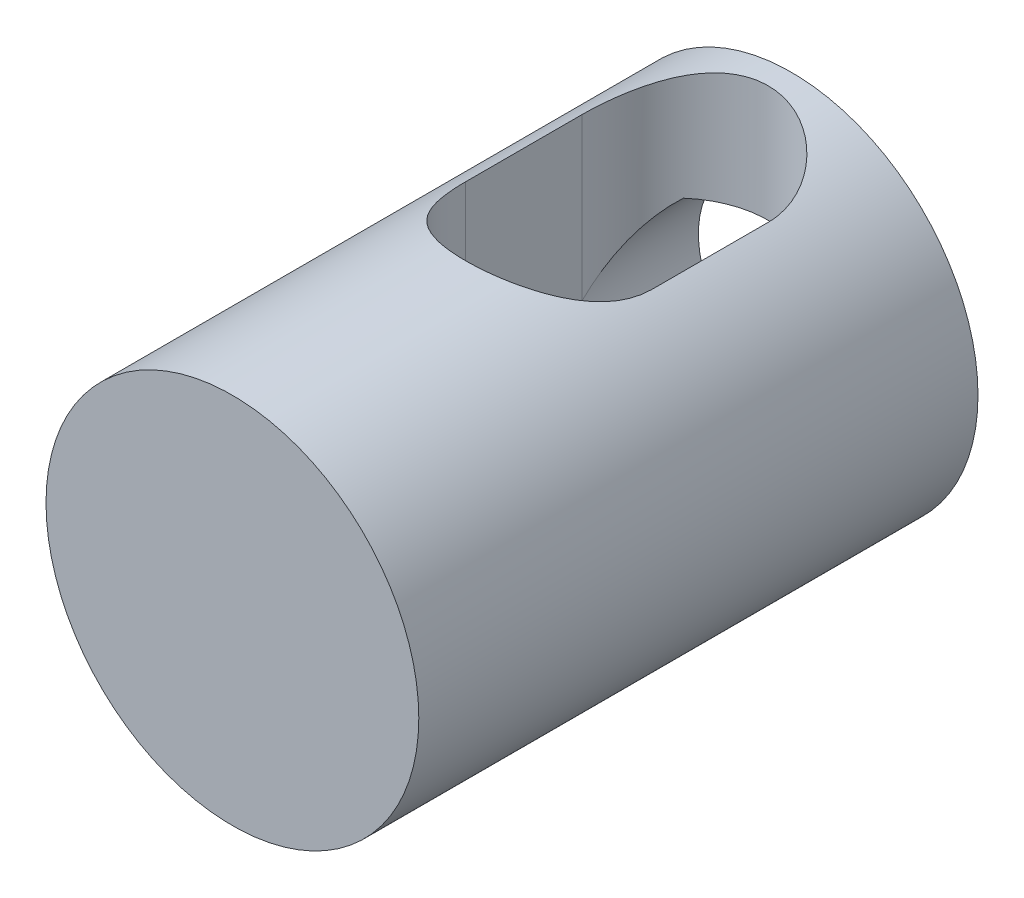
from build123d import *

# Parameters (mm, degrees)
CROQUIS1_R              = 4
SALIENTE_EXTRUIR1_DEPTH = 12
CORTAR_EXTRUIR2_DEPTH   = 8
CORTAR_EXTRUIR3_START   = -2.5000001
CORTAR_EXTRUIR3_DEPTH   = 4.0000001


# Read off the part's stored shape, not the designer's step: Cortar-Extruir3
with BuildPart() as part:
    # Croquis1 → Saliente-Extruir1 (new body)
    with BuildSketch(Plane.XY):
        Circle(CROQUIS1_R)
    extrude(amount=SALIENTE_EXTRUIR1_DEPTH)

    # Croquis1<5> → Cortar-Extruir2 (cut)
    with BuildSketch(Plane.XY):
        with BuildLine():
            Line((-1.322875656, 1.5), (1.322875656, 1.5))
            ThreePointArc((1.322875656, 1.5), (0, -2), (-1.322875656, 1.5))
        make_face()
    extrude(amount=CORTAR_EXTRUIR2_DEPTH, mode=Mode.SUBTRACT)

    # Cortar-Extruir3 outline → Cortar-Extruir3 (cut)
    with BuildSketch(Plane.XZ.offset(-1.5).offset(CORTAR_EXTRUIR3_START)):
        with BuildLine():
            ThreePointArc((2, 5), (0, 7), (-2, 5))
            Line((-2, 5), (-2, 2.5))
            ThreePointArc((-2, 2.5), (0, 0.5), (2, 2.5))
            Line((2, 2.5), (2, 5))
        make_face()
    extrude(amount=CORTAR_EXTRUIR3_DEPTH, mode=Mode.SUBTRACT)


solid = part.part
